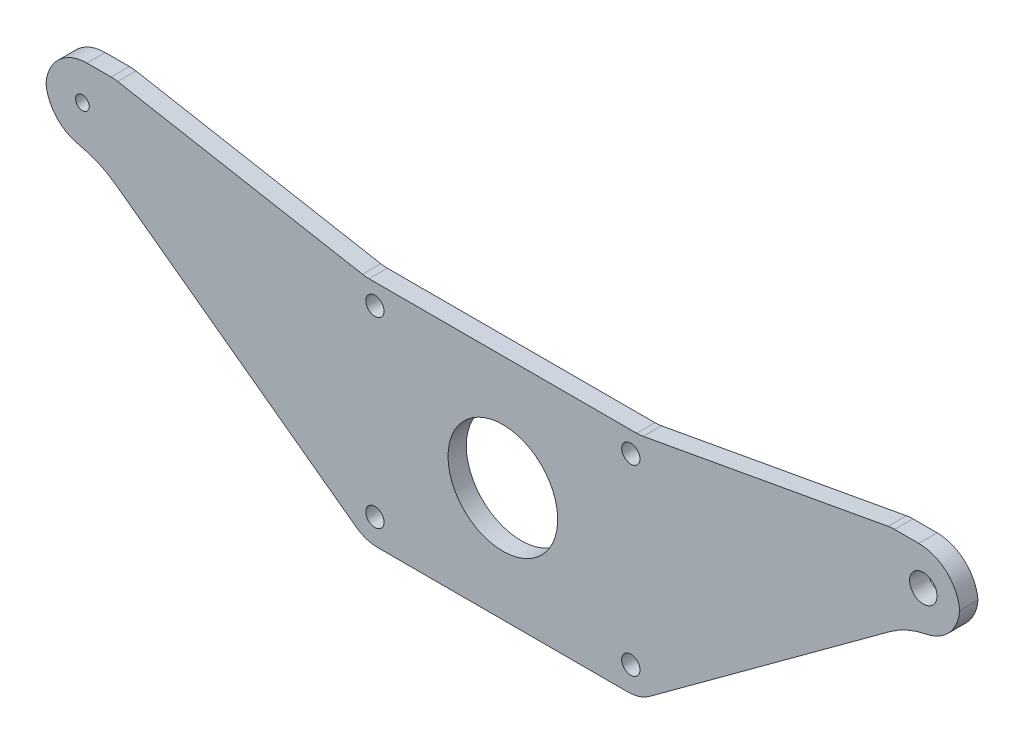
from build123d import *

# Parameters (mm, degrees)
EXTRUDE_1_DEPTH     = 4
FILLET_1_R          = 8
FILLET_2_R          = 20
SKETCH_3_R          = 2
CUT_EXTRUDE_2_DEPTH = 112.874930168
SKETCH_2_R          = 12
CUT_EXTRUDE_1_DEPTH = 112.874930168
SKETCH_4_R          = 1.5
CUT_EXTRUDE_3_DEPTH = 112.874930168
FILLET_3_R          = 9
SKETCH_5_R          = 3
SKETCH_5_R_2        = 1.5
CUT_EXTRUDE_4_DEPTH = 25


with BuildPart() as part:
    # 草图1 → 凸台-拉伸1 (new body)
    with BuildSketch(Plane.XY):
        Polygon((-100, 10), (-85, 10), (-30, 0), (30, 0), (85, 10), (100, 10), (100, -6), (90, -6), (30, -50), (-30, -50), (-90, -6), (-100, -6), align=None)
    extrude(amount=EXTRUDE_1_DEPTH)

    # 圆角1
    fillet_1_edges = [part.edges().sort_by_distance(p)[0] for p in [
        (-85, 10, 2),
        (-30, 0, 2),
        (30, 0, 2),
        (85, 10, 2),
        (30, -50, 2),
        (-30, -50, 2),
    ]]
    fillet(fillet_1_edges, radius=FILLET_1_R)

    # 圆角2
    fillet_2_edges = [part.edges().sort_by_distance(p)[0] for p in [
        (90, -6, 2),
        (-90, -6, 2),
    ]]
    fillet(fillet_2_edges, radius=FILLET_2_R)

    # 草图3 → 切除-拉伸2 (cut, through all)
    with BuildSketch(Plane(origin=(0, 0, 0), x_dir=(-1, 0, 0), z_dir=(0, 0, -1))):
        with Locations((-28, -4.5)):
            Circle(SKETCH_3_R)
        with Locations((-28, -44.5)):
            Circle(SKETCH_3_R)
    cut_extrude_2 = extrude(amount=-CUT_EXTRUDE_2_DEPTH, mode=Mode.SUBTRACT)

    # 草图2 → 切除-拉伸1 (cut, through all)
    with BuildSketch(Plane(origin=(0, 0, 0), x_dir=(-1, 0, 0), z_dir=(0, 0, -1))):
        with Locations((0, -25)):
            Circle(SKETCH_2_R)
    extrude(amount=-CUT_EXTRUDE_1_DEPTH, mode=Mode.SUBTRACT)

    # 镜向1: 切除-拉伸2 across plane
    add(cut_extrude_2.mirror(Plane(origin=(0, 0, 0), x_dir=(0, 0, 1), z_dir=(1, 0, 0))), mode=Mode.SUBTRACT)

    # 草图4 → 切除-拉伸3 (cut, through all)
    with BuildSketch(Plane(origin=(0, 0, 0), x_dir=(-1, 0, 0), z_dir=(0, 0, -1))):
        with Locations((92, 2)):
            Circle(SKETCH_4_R)
    cut_extrude_3 = extrude(amount=-CUT_EXTRUDE_3_DEPTH, mode=Mode.SUBTRACT)

    # 镜向2: 切除-拉伸3 across plane
    add(cut_extrude_3.mirror(Plane(origin=(0, 0, 0), x_dir=(0, 0, 1), z_dir=(1, 0, 0))), mode=Mode.SUBTRACT)

    # 圆角3
    # the kernel refuses this fillet: 9 mm, written as the material it takes off along each edge
    with BuildSketch(Plane(origin=(100, -6, -21.161183572), x_dir=(-0.9987150456948208, -0.05067797847972915, 0), z_dir=(0, 0, 1))) as fillet_3_piece_1:
        with BuildLine():
            CenterArc((8.559473009, -8.909698774), FILLET_3_R, 98.123197137, 78.971924263)
            Line((-0.428962402, -8.453596967), (-1.327805943, -8.407986787))
            Line((-1.327805943, -8.407986787), (-0.898843541, 0.045610181))
            Line((-0.898843541, 0.045610181), (0.045610181, 0.898843541))
            ThreePointArc((0.045610181, 0.898843541), (3.493764236, 0.723873235), (7.160582737, 0.890969877))
            Line((7.160582737, 0.890969877), (7.28775458, 0))
        make_face()
    extrude(amount=46.322367144, mode=Mode.SUBTRACT)
    with BuildSketch(Plane(origin=(100, 10, -22.5), x_dir=(0, -1, 0), z_dir=(0, 0, 1))) as fillet_3_piece_2:
        with BuildLine():
            CenterArc((FILLET_3_R, -FILLET_3_R), FILLET_3_R, 90, 90)
            Line((0, -FILLET_3_R), (0, 0))
            Line((0, 0), (FILLET_3_R, 0))
        make_face()
    extrude(amount=49, mode=Mode.SUBTRACT)
    with BuildSketch(Plane(origin=(-100, -6, -21.161183572), x_dir=(0.9987150456948208, -0.05067797847972878, 0), z_dir=(0, 0, 1))) as fillet_3_piece_3:
        with BuildLine():
            CenterArc((8.559473009, 8.909698774), FILLET_3_R, 182.9048786, 78.971924263)
            Line((-0.428962402, 8.453596967), (-1.327805943, 8.407986787))
            Line((-1.327805943, 8.407986787), (-0.898843541, -0.045610181))
            Line((-0.898843541, -0.045610181), (0.045610181, -0.898843541))
            ThreePointArc((0.045610181, -0.898843541), (3.493764236, -0.723873235), (7.160582737, -0.890969877))
            Line((7.160582737, -0.890969877), (7.28775458, 0))
        make_face()
    extrude(amount=46.322367144, mode=Mode.SUBTRACT)
    with BuildSketch(Plane(origin=(-100, 10, -22.5), x_dir=(0, -1, 0), z_dir=(0, 0, 1))) as fillet_3_piece_4:
        with BuildLine():
            CenterArc((FILLET_3_R, FILLET_3_R), FILLET_3_R, 180, 90)
            Line((0, FILLET_3_R), (0, 0))
            Line((0, 0), (FILLET_3_R, 0))
        make_face()
    extrude(amount=49, mode=Mode.SUBTRACT)

    # 草图5 → 切除-拉伸4 (cut)
    with BuildSketch(Plane(origin=(0, 0, 0), x_dir=(-1, 0, 0), z_dir=(0, 0, -1))):
        with Locations((-92, 2)):
            Circle(SKETCH_5_R)
        with Locations((-92, 2)):
            Circle(SKETCH_5_R_2, mode=Mode.SUBTRACT)
    extrude(amount=-CUT_EXTRUDE_4_DEPTH, mode=Mode.SUBTRACT)


solid = part.part
